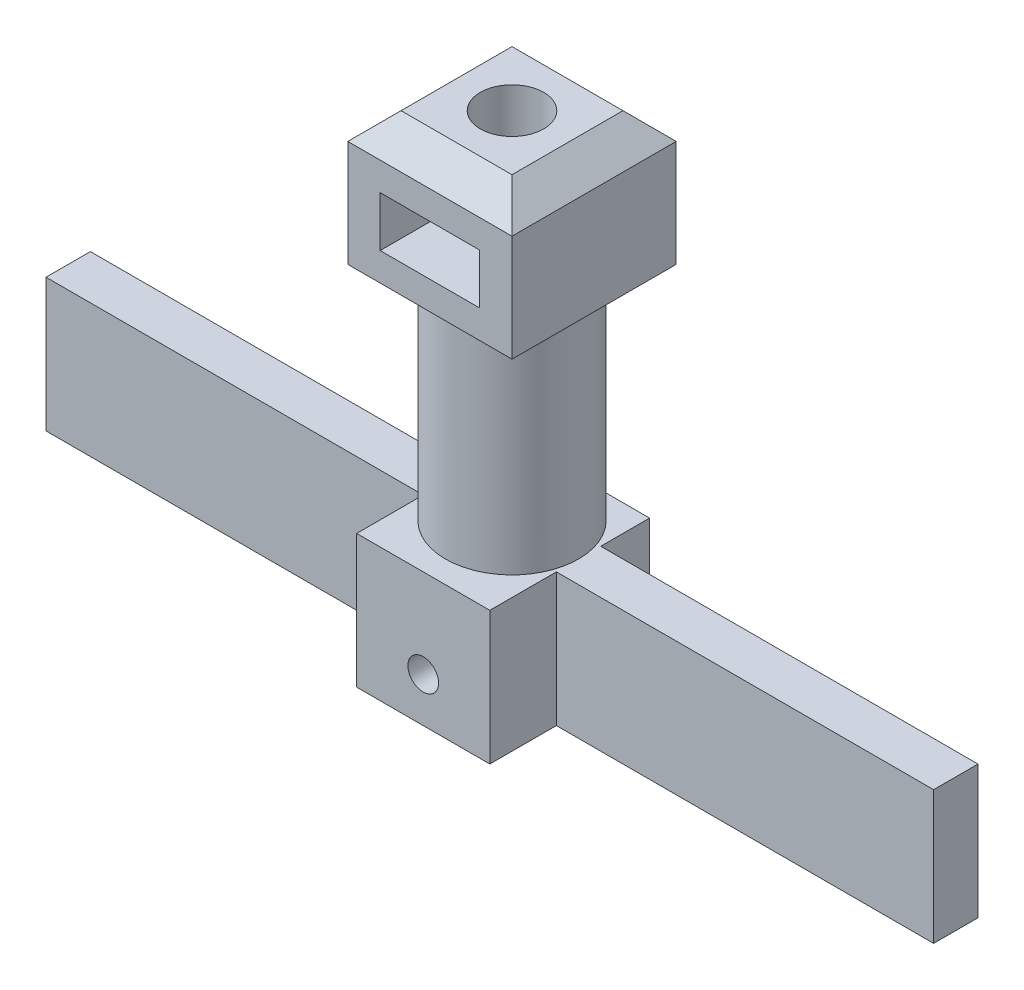
from build123d import *

# Parameters (mm, degrees)
SKETCH1_W                   = 100
SKETCH1_H                   = 10
BOSS_EXTRUDE1_DEPTH         = 15
SKETCH2_R                   = 7.5
BOSS_EXTRUDE2_DEPTH         = 20
SKETCH3_W                   = 18.5
SKETCH3_H                   = 18.5
BOSS_EXTRUDE3_DEPTH         = 20
CHAMFER1_SIZE               = 3
CHAMFER2_SIZE               = 5
SKETCH4_W                   = 11.2
SKETCH4_H                   = 5.65
CUT_EXTRUDE1_DEPTH          = 116.616824035
F_1_4_CLEARANCE_HOLE1_D     = 7.14248
F_1_4_CLEARANCE_HOLE1_DEPTH = 25
F_1_4_CLEARANCE_HOLE1_TIP   = 2.145817477
SKETCH8_W                   = 15
SKETCH8_H                   = 15
BOSS_EXTRUDE4_DEPTH         = 5
SKETCH9_R                   = 2.65
CUT_EXTRUDE2_DEPTH          = 25
F_4_CLEARANCE_HOLE1_D       = 3.4544
F_4_CLEARANCE_HOLE1_DEPTH   = 10
F_4_CLEARANCE_HOLE1_TIP     = 1.037806461
SKETCH13_W                  = 6.6
SKETCH13_H                  = 2.79
CUT_EXTRUDE3_DEPTH          = 7.7559
SKETCH14_W                  = 15
SKETCH14_H                  = 15
BOSS_EXTRUDE5_DEPTH         = 3
SKETCH15_W                  = 2.5
SKETCH15_H                  = 15
CUT_EXTRUDE4_DEPTH          = 42.5
SKETCH16_W                  = 2.5
SKETCH16_H                  = 15
CUT_EXTRUDE5_DEPTH          = 42.5


with BuildPart() as part:
    # Sketch1 → Boss-Extrude1 (new body)
    with BuildSketch(Plane(origin=(0, 0, 0), x_dir=(1, 0, 0), z_dir=(0, 1, 0))):
        with Locations((50, 5)):
            Rectangle(SKETCH1_W, SKETCH1_H)
    extrude(amount=BOSS_EXTRUDE1_DEPTH)

    # Sketch2 → Boss-Extrude2 (add)
    with BuildSketch(Plane(origin=(0, 15, 0), x_dir=(1, 0, 0), z_dir=(0, 1, 0))):
        with Locations(Location((50, 5, 0), (0, 0, 41.810314896))):
            Circle(SKETCH2_R)
    extrude(amount=BOSS_EXTRUDE2_DEPTH)

    # Sketch3 → Boss-Extrude3 (add)
    with BuildSketch(Plane(origin=(0, 35, 0), x_dir=(1, 0, 0), z_dir=(0, 1, 0))):
        with Locations((50, 5)):
            Rectangle(SKETCH3_W, SKETCH3_H)
    extrude(amount=BOSS_EXTRUDE3_DEPTH)

    # Chamfer1
    chamfer1_edges = [part.edges().sort_by_distance(p)[0] for p in [
        (40.75, 55, -5),
        (50, 55, 4.25),
        (59.25, 55, -5),
        (50, 55, -14.25),
    ]]
    chamfer(chamfer1_edges, length=CHAMFER1_SIZE)

    # Chamfer2
    # the kernel refuses this chamfer: 5 mm, written as the material it takes off along each edge
    with BuildSketch(Plane(origin=(27.89158506, 35, -14.25), x_dir=(0, 0.9996219169112968, -0.027495876610586317), z_dir=(1, 0, 0))) as chamfer2_piece_1_section:
        Polygon((CHAMFER2_SIZE * 0.999621916911, CHAMFER2_SIZE * 0.0274958766106), (-CHAMFER2_SIZE * 0.0274958766106, CHAMFER2_SIZE * 0.999621916911), (0, 0), align=None)
    chamfer2_piece_1 = extrude(amount=44.21682988, mode=Mode.PRIVATE)
    chamfer2_piece_1 = chamfer2_piece_1 - Plane(origin=(50, 36.70985324, -5), x_dir=(0.7453559924973537, 0, -0.6666666666695469), z_dir=(0, -1, 0)) * Cylinder(7.5, 109, mode=Mode.PRIVATE)
    with BuildSketch(Plane(origin=(40.75, 35, 17.10841494), x_dir=(-0.027495876610586317, 0.9996219169112968, 0), z_dir=(0, 0, -1))) as chamfer2_piece_2_section:
        Polygon((CHAMFER2_SIZE * 0.999621916911, CHAMFER2_SIZE * 0.0274958766106), (-CHAMFER2_SIZE * 0.0274958766106, CHAMFER2_SIZE * 0.999621916911), (0, 0), align=None)
    chamfer2_piece_2 = extrude(amount=44.21682988, mode=Mode.PRIVATE)
    chamfer2_piece_2 = chamfer2_piece_2 - Plane(origin=(50, 36.709853278, -5), x_dir=(0.7453559924973537, 0, -0.6666666666695469), z_dir=(0, -1, 0)) * Cylinder(7.5, 109, mode=Mode.PRIVATE)
    with BuildSketch(Plane(origin=(59.25, 35, -27.10841494), x_dir=(-0.9996219169112968, -0.027495876610586317, 0), z_dir=(0, 0, 1))) as chamfer2_piece_3_section:
        Polygon((CHAMFER2_SIZE * 0.999621916911, -CHAMFER2_SIZE * 0.0274958766106), (-CHAMFER2_SIZE * 0.0274958766106, -CHAMFER2_SIZE * 0.999621916911), (0, 0), align=None)
    chamfer2_piece_3 = extrude(amount=44.21682988, mode=Mode.PRIVATE)
    chamfer2_piece_3 = chamfer2_piece_3 - Plane(origin=(50, 36.709853248, -5), x_dir=(0.7453559924973537, 0, -0.6666666666695469), z_dir=(0, -1, 0)) * Cylinder(7.5, 109, mode=Mode.PRIVATE)
    with BuildSketch(Plane(origin=(72.10841494, 35, 4.25), x_dir=(0, -0.027495876610586317, -0.9996219169112968), z_dir=(-1, 0, 0))) as chamfer2_piece_4_section:
        Polygon((CHAMFER2_SIZE * 0.999621916911, -CHAMFER2_SIZE * 0.0274958766106), (-CHAMFER2_SIZE * 0.0274958766106, -CHAMFER2_SIZE * 0.999621916911), (0, 0), align=None)
    chamfer2_piece_4 = extrude(amount=44.21682988, mode=Mode.PRIVATE)
    chamfer2_piece_4 = chamfer2_piece_4 - Plane(origin=(50, 36.709853226, -5), x_dir=(0.7453559924973537, 0, -0.6666666666695469), z_dir=(0, -1, 0)) * Cylinder(7.5, 109, mode=Mode.PRIVATE)
    add([chamfer2_piece_1, chamfer2_piece_2, chamfer2_piece_3, chamfer2_piece_4], mode=Mode.SUBTRACT)

    # Sketch4 → Cut-Extrude1 (cut, through all)
    with BuildSketch(Plane.XY.offset(4.25)):
        with Locations((50, 46)):
            Rectangle(SKETCH4_W, SKETCH4_H)
    extrude(amount=-CUT_EXTRUDE1_DEPTH, mode=Mode.SUBTRACT)

    # 1/4 Clearance Hole1
    with Locations(Plane(origin=(0, 55, 0), x_dir=(1, 0, 0), z_dir=(0, 1, 0))):
        with Locations((50, 5)):
            Hole(F_1_4_CLEARANCE_HOLE1_D / 2, depth=F_1_4_CLEARANCE_HOLE1_DEPTH)
            with Locations((0, 0, -(F_1_4_CLEARANCE_HOLE1_DEPTH + F_1_4_CLEARANCE_HOLE1_TIP / 2))):  # 118° drill point
                Cone(0, F_1_4_CLEARANCE_HOLE1_D / 2, F_1_4_CLEARANCE_HOLE1_TIP, mode=Mode.SUBTRACT)

    # Sketch8 → Boss-Extrude4 (add)
    with BuildSketch(Plane.XY):
        with Locations((50, 7.5)):
            Rectangle(SKETCH8_W, SKETCH8_H)
    extrude(amount=BOSS_EXTRUDE4_DEPTH)

    # Sketch9 → Cut-Extrude2 (cut)
    with BuildSketch(Plane.XZ):
        with Locations(Location((50, -5, 0), (0, 0, 270))):
            Circle(SKETCH9_R)
    extrude(amount=-CUT_EXTRUDE2_DEPTH, mode=Mode.SUBTRACT)

    # #4 Clearance Hole1
    with Locations(Plane.XY.offset(5)):
        with Locations((50, 5)):
            Hole(F_4_CLEARANCE_HOLE1_D / 2, depth=F_4_CLEARANCE_HOLE1_DEPTH)
            with Locations((0, 0, -(F_4_CLEARANCE_HOLE1_DEPTH + F_4_CLEARANCE_HOLE1_TIP / 2))):  # 118° drill point
                Cone(0, F_4_CLEARANCE_HOLE1_D / 2, F_4_CLEARANCE_HOLE1_TIP, mode=Mode.SUBTRACT)

    # Sketch13 → Cut-Extrude3 (cut)
    with BuildSketch(Plane.XZ):
        with Locations((50, 1.105)):
            Rectangle(SKETCH13_W, SKETCH13_H)
    extrude(amount=-CUT_EXTRUDE3_DEPTH, mode=Mode.SUBTRACT)

    # Sketch14 → Boss-Extrude5 (add)
    with BuildSketch(Plane(origin=(0, 0, -10), x_dir=(-1, 0, 0), z_dir=(0, 0, -1))):
        with Locations((-50, 7.5)):
            Rectangle(SKETCH14_W, SKETCH14_H)
    extrude(amount=BOSS_EXTRUDE5_DEPTH)

    # Sketch15 → Cut-Extrude4 (cut)
    with BuildSketch(Plane(origin=(100, 0, 0), x_dir=(0, 0, -1), z_dir=(1, 0, 0))):
        with Locations((1.25, 7.5)):
            Rectangle(SKETCH15_W, SKETCH15_H)
        with Locations((8.75, 7.5)):
            Rectangle(SKETCH15_W, SKETCH15_H)
    extrude(amount=-CUT_EXTRUDE4_DEPTH, mode=Mode.SUBTRACT)

    # Sketch16 → Cut-Extrude5 (cut)
    with BuildSketch(Plane.ZY):
        with Locations((-8.75, 7.5)):
            Rectangle(SKETCH16_W, SKETCH16_H)
        with Locations((-1.25, 7.5)):
            Rectangle(SKETCH16_W, SKETCH16_H)
    extrude(amount=-CUT_EXTRUDE5_DEPTH, mode=Mode.SUBTRACT)


solid = part.part
